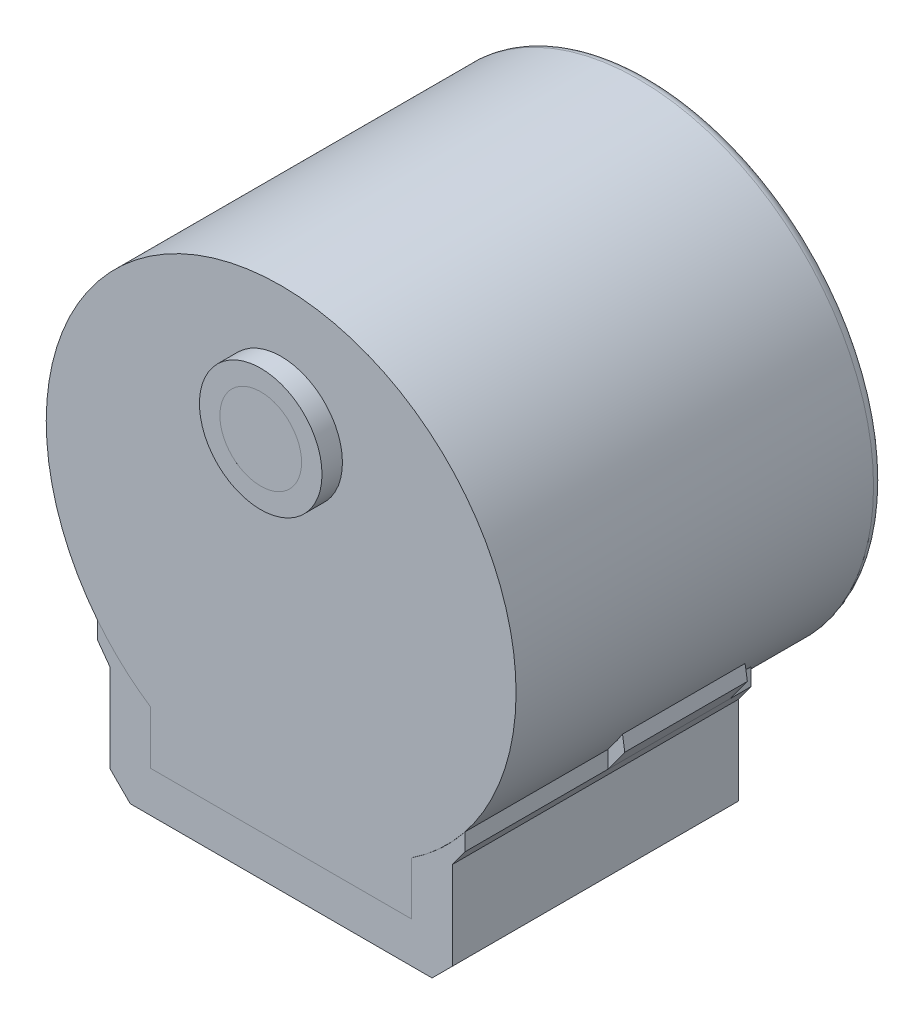
from build123d import *

# Parameters (mm, degrees)
SKETCH1_R             = 11.5
BOSS_EXTRUDE1_DEPTH   = 18
BOSS_EXTRUDE4_DEPTH   = 14
CHAMFER2_SIZE         = 1
BOSS_EXTRUDE5_DEPTH   = 6
BOSS_EXTRUDE5_2_DEPTH = 6
FILLET1_R             = 0.5
BOSS_EXTRUDE9_DEPTH   = 0.0001
SKETCH10_R            = 3
BOSS_EXTRUDE10_DEPTH  = 1
SKETCH12_R            = 2
CUT_EXTRUDE2_DEPTH    = 1
SKETCH6_R             = 3
BOSS_EXTRUDE6_DEPTH   = 1
SKETCH13_R            = 10.326369643
BOSS_EXTRUDE11_DEPTH  = 0.001
BOSS_EXTRUDE13_DEPTH  = 0.0001
BOSS_EXTRUDE14_DEPTH  = 0.0001
BOSS_EXTRUDE15_DEPTH  = 0.0001


with BuildPart() as part:
    # Sketch1 → Boss-Extrude1 (new body)
    with BuildSketch(Plane.XY):
        Circle(SKETCH1_R)
    extrude(amount=BOSS_EXTRUDE1_DEPTH)

    # Sketch2 → Boss-Extrude4 (add)
    with BuildSketch(Plane.XY.offset(18)):
        Polygon((-9, -7.158910532), (9, -7.158910532), (9, -8.001421733), (8.388098891, -8.843932934), (8.388098891, -14.158910532), (-8.388098891, -14.158910532), (-8.388098891, -8.843932934), (-9, -8.001421733), align=None)
    extrude(amount=-BOSS_EXTRUDE4_DEPTH)

    # Chamfer2
    chamfer2_edges = [part.edges().sort_by_distance(p)[0] for p in [
        (8.388098891, -14.158910532, 11),
        (-8.388098891, -14.158910532, 11),
    ]]
    chamfer(chamfer2_edges, length=CHAMFER2_SIZE)

    # Fillet1
    fillet1_edges = [part.edges().sort_by_distance(p)[0] for p in [
        (-11.5, 0, 0),
    ]]
    fillet(fillet1_edges, radius=FILLET1_R)

    # Sketch9 → Boss-Extrude9 (add)
    with BuildSketch(Plane.XY.offset(18)):
        with BuildLine():
            Line((-6.388098891, -9.562541114), (-6.388098891, -12.158910532))
            Line((-6.388098891, -12.158910532), (6.388098891, -12.158910532))
            Line((6.388098891, -12.158910532), (6.388098891, -9.562541114))
            ThreePointArc((6.388098891, -9.562541114), (0, 11.5), (-6.388098891, -9.562541114))
        make_face()
    extrude(amount=BOSS_EXTRUDE9_DEPTH)

    # Sketch10 → Boss-Extrude10 (add)
    with BuildSketch(Plane.XY.offset(18.0001)):
        with Locations((0, 5.5)):
            Circle(SKETCH10_R)
    extrude(amount=BOSS_EXTRUDE10_DEPTH)

    # Sketch12 → Cut-Extrude2 (cut)
    with BuildSketch(Plane.XY.offset(19.0001)):
        with Locations((0, 5.5)):
            Circle(SKETCH12_R)
    extrude(amount=-CUT_EXTRUDE2_DEPTH, mode=Mode.SUBTRACT)

    # Sketch6 → Boss-Extrude6 (add)
    with BuildSketch(Plane.XY.offset(18)):
        with Locations((0, 5.5)):
            Circle(SKETCH6_R)
    extrude(amount=BOSS_EXTRUDE6_DEPTH)

    # Sketch13 → Boss-Extrude11 (add)
    with BuildSketch(Plane(origin=(0, 0, 0), x_dir=(-1, 0, 0), z_dir=(0, 0, -1))):
        Circle(SKETCH13_R)
    extrude(amount=BOSS_EXTRUDE11_DEPTH)

    # Sketch15 → Boss-Extrude13 (add)
    # profile 1 of 4: a face of its own
    with BuildSketch(Plane(origin=(0, 0, -0.001), x_dir=(-1, 0, 0), z_dir=(0, 0, -1))):
        with BuildLine():
            Line((-3.525948268, 2.886972128), (-3.0540933, 2.886972128))
            add(Edge.make_bspline(
                [(-3.0540933, 2.886972128), (-3.022543158, 2.886821436), (-2.962239571, 2.886533409), (-2.875485529, 2.88481025), (-2.796763179, 2.880101897), (-2.725820575, 2.875989375), (-2.663254001, 2.868436735), (-2.608367845, 2.861342564), (-2.56123852, 2.851756311), (-2.532876882, 2.843220104), (-2.519838492, 2.839295846)],
                knots=[0, 0, 0, 0, 1.407275241, 2.689805482, 3.869373952, 4.924720992, 5.858292571, 6.679408083, 7.392898528, 8, 8, 8, 8], degree=3))
            add(Edge.make_bspline(
                [(-2.519838492, 2.839295846), (-2.502604036, 2.832914271), (-2.467997406, 2.820100128), (-2.418974943, 2.793550707), (-2.37188824, 2.762822521), (-2.327272396, 2.726853288), (-2.286048036, 2.684987409), (-2.246624288, 2.638786935), (-2.21003462, 2.587031801), (-2.176143356, 2.53076706), (-2.144861926, 2.470330489), (-2.11886731, 2.405749743), (-2.095040047, 2.338412458), (-2.07746815, 2.26712436), (-2.062228284, 2.193085978), (-2.053000074, 2.115211985), (-2.046279623, 2.034292327), (-2.045549696, 1.979034569), (-2.045179037, 1.950974532)],
                knots=[0, 0, 0, 0, 0.821157898, 1.648877476, 2.486832402, 3.334190097, 4.20646043, 5.111323736, 6.04828789, 7.037949131, 8.047833053, 9.088416927, 10.149643438, 11.239924972, 12.369590127, 13.528810539, 14.745123422, 16, 16, 16, 16], degree=3))
            add(Edge.make_bspline(
                [(-2.045179037, 1.950974532), (-2.046116805, 1.904405086), (-2.047938248, 1.813952451), (-2.066022358, 1.682720441), (-2.094477668, 1.560029388), (-2.134073946, 1.446505899), (-2.184228953, 1.343791524), (-2.244722313, 1.253250991), (-2.316337383, 1.177008838), (-2.383651923, 1.123712025), (-2.443252575, 1.088860896), (-2.491924385, 1.065731308), (-2.545021807, 1.047222368), (-2.601524755, 1.030643885), (-2.66230531, 1.018402837), (-2.72714964, 1.009288019), (-2.795981898, 1.003635525), (-2.843278498, 1.002790958), (-2.867594903, 1.002356744)],
                knots=[0, 0, 0, 0, 1.559350929, 3.028754108, 4.428415989, 5.773036121, 7.047604298, 8.248499058, 9.406249285, 10.538623137, 11.110667115, 11.716589909, 12.340703643, 12.992445201, 13.688047783, 14.415527693, 15.185381842, 16, 16, 16, 16], degree=3))
            Line((-2.867594903, 1.002356744), (-2.000307242, -0.613027872))
            Line((-2.000307242, -0.613027872), (-2.284962691, -0.613027872))
            Line((-2.284962691, -0.613027872), (-3.152250351, 1.002356744))
            Line((-3.152250351, 1.002356744), (-3.301589294, 1.002356744))
            Line((-3.301589294, 1.002356744), (-3.301589294, -0.613027872))
            Line((-3.301589294, -0.613027872), (-3.525948268, -0.613027872))
            Line((-3.525948268, -0.613027872), (-3.525948268, 2.886972128))
        make_face()
        with BuildLine():
            Line((-3.301589294, 2.527997769), (-3.301589294, 1.361331103))
            Line((-3.301589294, 1.361331103), (-2.880215095, 1.35642325))
            add(Edge.make_bspline(
                [(-2.880215095, 1.35642325), (-2.842090464, 1.357196131), (-2.770770506, 1.358641964), (-2.671720464, 1.369876633), (-2.588225294, 1.389569404), (-2.518805075, 1.418568227), (-2.461788775, 1.458386516), (-2.411484889, 1.505773149), (-2.369914839, 1.564588606), (-2.33317962, 1.630891376), (-2.305485445, 1.704827337), (-2.283683581, 1.78328458), (-2.272141419, 1.866263547), (-2.27041514, 1.922898991), (-2.269538012, 1.951675654)],
                knots=[0, 0, 0, 0, 1.395459073, 2.610493045, 3.641753297, 4.526968964, 5.345645002, 6.17462708, 7.043906644, 7.970450467, 8.942786324, 9.926497544, 10.946446294, 12, 12, 12, 12], degree=3))
            add(Edge.make_bspline(
                [(-2.269538012, 1.951675654), (-2.270296535, 1.979776002), (-2.271789909, 2.035099721), (-2.285050012, 2.115850198), (-2.304755059, 2.193128976), (-2.334707846, 2.264641449), (-2.369232983, 2.33034316), (-2.411159424, 2.386339786), (-2.457612296, 2.433014488), (-2.512091952, 2.469911656), (-2.57845377, 2.49725898), (-2.660457763, 2.514888177), (-2.759506001, 2.52684396), (-2.831559764, 2.527593656), (-2.87039939, 2.527997769)],
                knots=[0, 0, 0, 0, 1.050889885, 2.068982756, 3.055515424, 4.02842232, 4.963806102, 5.826211733, 6.636431298, 7.417566748, 8.27204102, 9.305238015, 10.547424284, 12, 12, 12, 12], degree=3))
            Line((-2.87039939, 2.527997769), (-3.301589294, 2.527997769))
        make_face(mode=Mode.SUBTRACT)
    # profile 2 of 4: a face of its own
    with BuildSketch(Plane(origin=(0, 0, -0.001), x_dir=(-1, 0, 0), z_dir=(0, 0, -1))):
        with BuildLine():
            add(Edge.make_bspline(
                [(-0.743195864, 1.989536231), (-0.710589609, 1.988507722), (-0.64634692, 1.986481296), (-0.552508143, 1.964760899), (-0.462871147, 1.931773349), (-0.37694895, 1.885938213), (-0.296812751, 1.82519744), (-0.220680608, 1.752049352), (-0.147904169, 1.66643579), (-0.105858781, 1.601633762), (-0.084141377, 1.568162032)],
                knots=[0, 0, 0, 0, 0.953316864, 1.878278806, 2.805087309, 3.745143774, 4.718373443, 5.739791154, 6.832550422, 8, 8, 8, 8], degree=3))
            add(Edge.make_bspline(
                [(-0.084141377, 1.568162032), (-0.065135071, 1.535730892), (-0.026928901, 1.47053834), (0.020643433, 1.367200418), (0.062925409, 1.260359595), (0.095391369, 1.148214899), (0.121237717, 1.032040533), (0.140321271, 0.911490445), (0.15173039, 0.786634728), (0.152930173, 0.701833163), (0.153538911, 0.658807064)],
                knots=[0, 0, 0, 0, 0.947011543, 1.903667277, 2.864215, 3.840975266, 4.842905076, 5.862773124, 6.915626928, 8, 8, 8, 8], degree=3))
            add(Edge.make_bspline(
                [(0.153538911, 0.658807064), (0.152619153, 0.615551673), (0.150806387, 0.530298988), (0.139799083, 0.404429046), (0.119809642, 0.282718404), (0.093087468, 0.164844072), (0.056470536, 0.051597044), (0.014464393, -0.058142322), (-0.03757542, -0.162959432), (-0.095405433, -0.263003454), (-0.159659091, -0.354954175), (-0.229469456, -0.435523317), (-0.303185442, -0.504540718), (-0.382558608, -0.560475657), (-0.466219136, -0.604274383), (-0.554422967, -0.635628062), (-0.647294468, -0.65425469), (-0.710859449, -0.656670639), (-0.743195864, -0.657899667)],
                knots=[0, 0, 0, 0, 1.179143013, 2.323990292, 3.440410231, 4.539095879, 5.614957591, 6.682013268, 7.739000084, 8.801004604, 9.829641189, 10.791486682, 11.702119209, 12.575235445, 13.43003252, 14.26821791, 15.119017693, 16, 16, 16, 16], degree=3))
            add(Edge.make_bspline(
                [(-0.743195864, -0.657899667), (-0.775532651, -0.656661644), (-0.839327752, -0.654219231), (-0.932631482, -0.635578916), (-1.021256817, -0.60461203), (-1.104674954, -0.560270624), (-1.183949407, -0.504348481), (-1.258326948, -0.435775102), (-1.328102181, -0.354918756), (-1.392392814, -0.263012063), (-1.450236883, -0.162962896), (-1.502181061, -0.058119893), (-1.544534351, 0.051444207), (-1.57973647, 0.165093893), (-1.607906889, 0.282587084), (-1.627507054, 0.404450689), (-1.638622845, 0.530293329), (-1.640420693, 0.615549769), (-1.641332883, 0.658807064)],
                knots=[0, 0, 0, 0, 0.880385174, 1.73685346, 2.58047298, 3.429050009, 4.301574444, 5.216276051, 6.177469602, 7.205408974, 8.266693664, 9.322964051, 10.389296474, 11.462523686, 12.56192169, 13.677584916, 14.821656214, 16, 16, 16, 16], degree=3))
            add(Edge.make_bspline(
                [(-1.641332883, 0.658807064), (-1.640718731, 0.701599303), (-1.639505023, 0.786166817), (-1.628106948, 0.910788353), (-1.609097322, 1.03111742), (-1.583231824, 1.14683842), (-1.550405234, 1.258609915), (-1.508802809, 1.365486644), (-1.460648925, 1.46856849), (-1.422622563, 1.533611218), (-1.403652595, 1.566058667)],
                knots=[0, 0, 0, 0, 1.08079722, 2.135909171, 3.15796462, 4.156281795, 5.129476821, 6.097590791, 7.050957319, 8, 8, 8, 8], degree=3))
            add(Edge.make_bspline(
                [(-1.403652595, 1.566058667), (-1.381987287, 1.599807303), (-1.340140665, 1.664992919), (-1.266812476, 1.750557496), (-1.191221004, 1.82483722), (-1.109984065, 1.884851002), (-1.024458503, 1.931953185), (-0.934343059, 1.964820985), (-0.840269713, 1.986426275), (-0.775800854, 1.988491664), (-0.743195864, 1.989536231)],
                knots=[0, 0, 0, 0, 1.169336495, 2.258577748, 3.281427306, 4.257001412, 5.197279076, 6.121103825, 7.049752231, 8, 8, 8, 8], degree=3))
        make_face()
        with BuildLine():
            add(Edge.make_bspline(
                [(-0.743896986, 1.675433667), (-0.766642891, 1.674472866), (-0.811637456, 1.67257227), (-0.877710121, 1.657849735), (-0.941216002, 1.634686658), (-1.002359095, 1.601884174), (-1.060621224, 1.55920574), (-1.11685676, 1.507777727), (-1.170439148, 1.446908912), (-1.220012642, 1.377226269), (-1.265938076, 1.301295044), (-1.306866394, 1.220902774), (-1.340185821, 1.136140645), (-1.368742421, 1.048014741), (-1.390226864, 0.955565999), (-1.40528395, 0.859236299), (-1.41584218, 0.759300695), (-1.416592053, 0.69132088), (-1.416973909, 0.656703699)],
                knots=[0, 0, 0, 0, 0.812010353, 1.606269465, 2.406649113, 3.220974234, 4.076097956, 4.98035605, 5.938625786, 6.967482768, 8.03141706, 9.10682197, 10.18594796, 11.281773775, 12.413897075, 13.572437299, 14.763818652, 16, 16, 16, 16], degree=3))
            add(Edge.make_bspline(
                [(-1.416973909, 0.656703699), (-1.415901089, 0.61201679), (-1.41378136, 0.523722281), (-1.396790937, 0.393577642), (-1.367702487, 0.268415793), (-1.329065306, 0.149221539), (-1.280556042, 0.038807245), (-1.223240272, -0.059604316), (-1.158394734, -0.145316042), (-1.085332712, -0.216424896), (-1.006170238, -0.273057231), (-0.922206753, -0.313456407), (-0.834526978, -0.339868628), (-0.774230799, -0.342482244), (-0.743896986, -0.343797103)],
                knots=[0, 0, 0, 0, 1.20838902, 2.38759222, 3.542210294, 4.679604706, 5.771967188, 6.797545264, 7.753349372, 8.669734747, 9.544904936, 10.373258743, 11.181618685, 12, 12, 12, 12], degree=3))
            add(Edge.make_bspline(
                [(-0.743896986, -0.343797103), (-0.713561541, -0.34248469), (-0.65326212, -0.339875937), (-0.565606635, -0.313427291), (-0.481719482, -0.273254725), (-0.403071722, -0.216200954), (-0.330130409, -0.145129382), (-0.264463736, -0.059848361), (-0.207285701, 0.038842792), (-0.158714932, 0.149211319), (-0.120095286, 0.268418622), (-0.091001992, 0.393576865), (-0.074012883, 0.523722483), (-0.071892974, 0.612016858), (-0.070820063, 0.656703699)],
                knots=[0, 0, 0, 0, 0.81846946, 1.626916467, 2.455359493, 3.325471984, 4.241956059, 5.201722598, 6.227411136, 7.319891272, 8.457408188, 9.612150622, 10.791480829, 12, 12, 12, 12], degree=3))
            add(Edge.make_bspline(
                [(-0.070820063, 0.656703699), (-0.071201365, 0.691321118), (-0.071950152, 0.759301399), (-0.082516235, 0.859233631), (-0.097544714, 0.955575614), (-0.119132016, 1.047980191), (-0.14734683, 1.136347823), (-0.182014031, 1.220513381), (-0.221558098, 1.301702833), (-0.268571996, 1.377214016), (-0.31872674, 1.446765869), (-0.372323794, 1.507534676), (-0.427904998, 1.559427217), (-0.486162875, 1.601854516), (-0.547272157, 1.634694125), (-0.610786858, 1.657848384), (-0.676628287, 1.672519397), (-0.721386103, 1.674458432), (-0.743896986, 1.675433667)],
                knots=[0, 0, 0, 0, 1.236632221, 2.428448107, 3.587410887, 4.719947107, 5.816172602, 6.898822026, 7.970883808, 9.039556281, 10.073691182, 11.032310428, 11.93074605, 12.786181662, 13.600803792, 14.401475363, 15.196024166, 16, 16, 16, 16], degree=3))
        make_face(mode=Mode.SUBTRACT)
    # profile 3 of 4: a face of its own
    with BuildSketch(Plane(origin=(0, 0, -0.001), x_dir=(-1, 0, 0), z_dir=(0, 0, -1))):
        Polygon((0.69200045, 2.886972128), (0.916359424, 2.886972128), (0.916359424, 1.451074692), (2.127897886, 1.451074692), (2.127897886, 2.886972128), (2.35225686, 2.886972128), (2.35225686, -0.613027872), (2.127897886, -0.613027872), (2.127897886, 1.092100333), (0.916359424, 1.092100333), (0.916359424, -0.613027872), (0.69200045, -0.613027872), align=None)
    # profile 4 of 4: a face of its own
    with BuildSketch(Plane(origin=(0, 0, -0.001), x_dir=(-1, 0, 0), z_dir=(0, 0, -1))):
        with BuildLine():
            Line((2.711231219, 0.062152417), (2.91455654, 0.239536231))
            add(Edge.make_bspline(
                [(2.91455654, 0.239536231), (2.933533222, 0.193666723), (2.969498501, 0.106733211), (3.030582826, -0.012164853), (3.09314987, -0.113625777), (3.159100106, -0.19622394), (3.226612002, -0.26207911), (3.297620886, -0.308665054), (3.371547177, -0.338400303), (3.422382857, -0.342016741), (3.447409104, -0.343797103)],
                knots=[0, 0, 0, 0, 1.4274707, 2.705392895, 3.841360332, 4.850387436, 5.739695495, 6.54155184, 7.282010527, 8, 8, 8, 8], degree=3))
            add(Edge.make_bspline(
                [(3.447409104, -0.343797103), (3.468781329, -0.342940802), (3.511394525, -0.34123346), (3.573948013, -0.324589181), (3.634791258, -0.29961567), (3.691944404, -0.263292271), (3.745336166, -0.219364882), (3.792361562, -0.167401847), (3.831977948, -0.108132865), (3.864714304, -0.043057128), (3.890203922, 0.026728093), (3.909272414, 0.098967992), (3.920990006, 0.173480951), (3.922171149, 0.223835352), (3.922769681, 0.249351936)],
                knots=[0, 0, 0, 0, 0.910355865, 1.815120956, 2.745047303, 3.708239851, 4.692884706, 5.688582042, 6.687272463, 7.726626752, 8.790156954, 9.852236194, 10.911642353, 12, 12, 12, 12], degree=3))
            add(Edge.make_bspline(
                [(3.922769681, 0.249351936), (3.921592063, 0.278395604), (3.919219226, 0.336917045), (3.902919128, 0.424050291), (3.874284608, 0.510009694), (3.84789866, 0.564886424), (3.834428334, 0.592901615)],
                knots=[0, 0, 0, 0, 0.973184621, 1.960915033, 2.959024035, 4, 4, 4, 4], degree=3))
            add(Edge.make_bspline(
                [(3.834428334, 0.592901615), (3.82343869, 0.612900832), (3.8005507, 0.65455294), (3.760186875, 0.716845089), (3.713582733, 0.782113764), (3.661347319, 0.850711063), (3.601832846, 0.92154823), (3.536813864, 0.995834024), (3.465248981, 1.072970095), (3.414589996, 1.124480962), (3.388514873, 1.150994564)],
                knots=[0, 0, 0, 0, 0.763930207, 1.591027513, 2.483480193, 3.449232408, 4.477278696, 5.580830734, 6.75480852, 8, 8, 8, 8], degree=3))
            add(Edge.make_bspline(
                [(3.388514873, 1.150994564), (3.36238899, 1.177227108), (3.312340278, 1.227480148), (3.243489079, 1.302319083), (3.18061586, 1.36972234), (3.126599886, 1.432552222), (3.079797583, 1.489069384), (3.039778151, 1.539351581), (3.009026021, 1.584984674), (2.991802989, 1.613901111), (2.983967597, 1.627056263)],
                knots=[0, 0, 0, 0, 1.418850322, 2.718056736, 3.897251478, 4.951422659, 5.8930247, 6.710073348, 7.413164863, 8, 8, 8, 8], degree=3))
            add(Edge.make_bspline(
                [(2.983967597, 1.627056263), (2.962706996, 1.668389477), (2.920354665, 1.7507276), (2.877664957, 1.882883709), (2.850290616, 2.019714542), (2.847339914, 2.112799693), (2.845846604, 2.159908827)],
                knots=[0, 0, 0, 0, 1.001108881, 1.994266056, 2.984925235, 4, 4, 4, 4], degree=3))
            add(Edge.make_bspline(
                [(2.845846604, 2.159908827), (2.846742376, 2.19688923), (2.848507238, 2.269748449), (2.863822542, 2.376265416), (2.887141196, 2.478247144), (2.921649074, 2.573727857), (2.964056294, 2.662456359), (3.014983575, 2.74180171), (3.074208991, 2.811129464), (3.140354774, 2.869938786), (3.21278064, 2.916988467), (3.288557616, 2.952119262), (3.368310505, 2.972408914), (3.422292942, 2.975272044), (3.449512469, 2.976715718)],
                knots=[0, 0, 0, 0, 1.181416684, 2.327640837, 3.432896955, 4.519774552, 5.565493565, 6.570422845, 7.524069226, 8.471345662, 9.389213005, 10.275123969, 11.130266921, 12, 12, 12, 12], degree=3))
            add(Edge.make_bspline(
                [(3.449512469, 2.976715718), (3.47841671, 2.975266012), (3.53651374, 2.972352126), (3.621742844, 2.947317895), (3.70329141, 2.906274379), (3.768163726, 2.860173451), (3.818490074, 2.814043838), (3.858027031, 2.772674292), (3.896803762, 2.723610515), (3.937906761, 2.669262447), (3.978012916, 2.607163501), (4.019781748, 2.539244221), (4.060670144, 2.463870979), (4.08807458, 2.4114148), (4.10225686, 2.384267801)],
                knots=[0, 0, 0, 0, 1.116951945, 2.245054374, 3.405965832, 4.638253071, 5.310557091, 6.04630686, 6.850074719, 7.729237936, 8.682511397, 9.709406364, 10.81457734, 12, 12, 12, 12], degree=3))
            Line((4.10225686, 2.384267801), (3.907345001, 2.16902341))
            add(Edge.make_bspline(
                [(3.907345001, 2.16902341), (3.895255987, 2.191026918), (3.872125908, 2.233126532), (3.837775451, 2.293256925), (3.804296209, 2.34702565), (3.771924871, 2.394899299), (3.741171, 2.437098427), (3.711726159, 2.473623812), (3.684038388, 2.504732269), (3.648678636, 2.537114827), (3.604443681, 2.569523445), (3.548315788, 2.597454655), (3.489520867, 2.614434305), (3.449387692, 2.61663385), (3.429179937, 2.617741359)],
                knots=[0, 0, 0, 0, 1.309793075, 2.506045177, 3.612360285, 4.613350274, 5.520539379, 6.33553705, 7.060566944, 7.690470518, 8.834311878, 9.908515481, 10.946901003, 12, 12, 12, 12], degree=3))
            add(Edge.make_bspline(
                [(3.429179937, 2.617741359), (3.403700373, 2.616511269), (3.354017455, 2.614112702), (3.283991396, 2.587729004), (3.22123389, 2.546800855), (3.168184304, 2.490079229), (3.123718923, 2.42324654), (3.093091885, 2.346538048), (3.073476921, 2.263022862), (3.071317005, 2.204662743), (3.070205578, 2.174632385)],
                knots=[0, 0, 0, 0, 0.957930279, 1.867880082, 2.78566855, 3.76545862, 4.778691267, 5.799579728, 6.867730067, 8, 8, 8, 8], degree=3))
            add(Edge.make_bspline(
                [(3.070205578, 2.174632385), (3.072077726, 2.137334298), (3.07581996, 2.062779183), (3.09818308, 1.970782647), (3.125880328, 1.897759621), (3.155352126, 1.841301487), (3.1903723, 1.781686104), (3.218278076, 1.742758337), (3.232865834, 1.722408827)],
                knots=[0, 0, 0, 0, 1.37118372, 2.740858038, 3.459154736, 4.239466331, 5.07968016, 6, 6, 6, 6], degree=3))
            add(Edge.make_bspline(
                [(3.232865834, 1.722408827), (3.238154763, 1.71555867), (3.250729774, 1.699271665), (3.274931461, 1.673318966), (3.305347067, 1.639509038), (3.343672125, 1.599737768), (3.388465573, 1.552236991), (3.441393532, 1.499276604), (3.500882886, 1.438877814), (3.542984019, 1.396376163), (3.565197565, 1.373951295)],
                knots=[0, 0, 0, 0, 0.430988114, 1.024721792, 1.76647773, 2.697202889, 3.776087901, 5.019389473, 6.42735995, 8, 8, 8, 8], degree=3))
            add(Edge.make_bspline(
                [(3.565197565, 1.373951295), (3.591978003, 1.346270382), (3.644064975, 1.292432019), (3.717840314, 1.211657022), (3.785360979, 1.133420293), (3.8455066, 1.056834681), (3.899835207, 0.983156535), (3.947760562, 0.911819971), (3.988542814, 0.842178142), (4.033883164, 0.753567409), (4.078471974, 0.643512194), (4.118610835, 0.511119168), (4.142535255, 0.377824302), (4.145604337, 0.288706249), (4.147128655, 0.244444083)],
                knots=[0, 0, 0, 0, 1.061650765, 2.064871852, 3.015192632, 3.909651769, 4.748487401, 5.538240563, 6.277422274, 6.971787199, 8.280588746, 9.544330434, 10.780345287, 12, 12, 12, 12], degree=3))
            add(Edge.make_bspline(
                [(4.147128655, 0.244444083), (4.146332143, 0.21311157), (4.144759583, 0.151251478), (4.13599318, 0.059965731), (4.119312203, -0.027971178), (4.098030024, -0.113305659), (4.069120501, -0.19532475), (4.033865315, -0.273934936), (3.993113094, -0.349728122), (3.945921744, -0.42085397), (3.894565516, -0.486493782), (3.839952159, -0.544392381), (3.782216513, -0.593299522), (3.721353652, -0.632923223), (3.657801377, -0.664108069), (3.591657547, -0.686650875), (3.522549846, -0.700643392), (3.475520429, -0.702054307), (3.451615834, -0.702771462)],
                knots=[0, 0, 0, 0, 1.158720575, 2.287673511, 3.385950382, 4.465299485, 5.536593632, 6.596465733, 7.64816921, 8.714678197, 9.748443524, 10.726384082, 11.652440184, 12.539243327, 13.404912843, 14.26295822, 15.117078591, 16, 16, 16, 16], degree=3))
            add(Edge.make_bspline(
                [(3.451615834, -0.702771462), (3.433114828, -0.702263561), (3.396386876, -0.701255282), (3.342235964, -0.69221577), (3.289098355, -0.679386442), (3.237953366, -0.65917584), (3.187674354, -0.634492358), (3.138611188, -0.604515288), (3.091418936, -0.568039809), (3.044882246, -0.526698851), (2.999579337, -0.478386581), (2.955739067, -0.422742721), (2.911959392, -0.360278562), (2.870354089, -0.289813201), (2.828748194, -0.21248503), (2.788491454, -0.127602169), (2.748099196, -0.035718499), (2.723779167, 0.02884223), (2.711231219, 0.062152417)],
                knots=[0, 0, 0, 0, 0.781108757, 1.550646757, 2.314652786, 3.086720919, 3.868391243, 4.679628978, 5.511108479, 6.385293484, 7.30741185, 8.305206797, 9.376292927, 10.527882923, 11.760494076, 13.085521883, 14.49627147, 16, 16, 16, 16], degree=3))
        make_face()
    extrude(amount=BOSS_EXTRUDE13_DEPTH)

    # Sketch16 → Boss-Extrude14 (add)
    # profile 1 of 7: a face of its own
    with BuildSketch(Plane(origin=(0, 0, -0.001), x_dir=(-1, 0, 0), z_dir=(0, 0, -1))):
        with BuildLine():
            Line((-2.92792156, 5.936670841), (-3.062536944, 5.936670841))
            add(Edge.make_bspline(
                [(-3.062536944, 5.936670841), (-3.061639613, 5.978280792), (-3.059884136, 6.059683584), (-3.0527546, 6.178701341), (-3.042513724, 6.292178156), (-3.027806152, 6.399760875), (-3.00945665, 6.501952287), (-2.988250242, 6.598549607), (-2.962047239, 6.689249907), (-2.932975286, 6.773583529), (-2.901319198, 6.850131408), (-2.867258873, 6.917256792), (-2.830570689, 6.973676276), (-2.793091415, 7.020898573), (-2.752632103, 7.05717834), (-2.710827559, 7.08411524), (-2.666192548, 7.100667313), (-2.635451413, 7.102449307), (-2.620129092, 7.103337508)],
                knots=[0, 0, 0, 0, 1.499044431, 2.932625415, 4.293837702, 5.602250345, 6.842368616, 8.033041629, 9.162785747, 10.241015594, 11.244734119, 12.144584578, 12.947813535, 13.665690747, 14.309565158, 14.895830339, 15.449648073, 16, 16, 16, 16], degree=3))
            add(Edge.make_bspline(
                [(-2.620129092, 7.103337508), (-2.60505573, 7.102393717), (-2.574878129, 7.100504201), (-2.531160826, 7.084992165), (-2.490667873, 7.059283868), (-2.451362153, 7.025375973), (-2.416201509, 6.98018603), (-2.382114926, 6.926309939), (-2.351200941, 6.862310084), (-2.311516703, 6.76328408), (-2.270172331, 6.625815802), (-2.234790202, 6.448125335), (-2.21369564, 6.256422838), (-2.211240563, 6.124158506), (-2.209972842, 6.055861546)],
                knots=[0, 0, 0, 0, 0.449190805, 0.899301807, 1.365979003, 1.875299848, 2.440824153, 3.06797826, 3.776272418, 4.558816679, 6.251583603, 8.052270926, 9.961522281, 12, 12, 12, 12], degree=3))
            add(Edge.make_bspline(
                [(-2.209972842, 6.055861546), (-2.21068331, 6.007000277), (-2.2120819, 5.910814495), (-2.222031989, 5.768760644), (-2.238518843, 5.631318772), (-2.259214554, 5.518932314), (-2.278702706, 5.427622906), (-2.297419008, 5.353928044), (-2.318079517, 5.274060417), (-2.343002137, 5.188683855), (-2.370084447, 5.097379731), (-2.401262913, 5.000792755), (-2.434786742, 4.898070219), (-2.458999106, 4.827928157), (-2.471491271, 4.79173895)],
                knots=[0, 0, 0, 0, 1.355088937, 2.66755837, 3.947484853, 5.192214577, 5.835517292, 6.536663773, 7.300749649, 8.123430825, 9.003169876, 9.942028091, 10.938206709, 12, 12, 12, 12], degree=3))
            Line((-2.471491271, 4.79173895), (-2.796110662, 3.872568277))
            Line((-2.796110662, 3.872568277), (-2.209972842, 3.872568277))
            Line((-2.209972842, 3.872568277), (-2.209972842, 3.513593918))
            Line((-2.209972842, 3.513593918), (-3.107408739, 3.513593918))
            Line((-3.107408739, 3.513593918), (-2.594888707, 4.962111546))
            add(Edge.make_bspline(
                [(-2.594888707, 4.962111546), (-2.582521597, 4.996706605), (-2.558634062, 5.063528256), (-2.523810545, 5.159961998), (-2.494101792, 5.25001932), (-2.466285075, 5.332758185), (-2.442750643, 5.408819242), (-2.422053826, 5.477901692), (-2.405258352, 5.540100313), (-2.387326194, 5.614207594), (-2.370133188, 5.703652564), (-2.355604128, 5.811557174), (-2.345938413, 5.922238838), (-2.345042505, 5.996946621), (-2.344588226, 6.034827892)],
                knots=[0, 0, 0, 0, 1.193533438, 2.305354461, 3.330536343, 4.274088284, 5.140971689, 5.916908005, 6.616757519, 7.233650198, 8.393579676, 9.573610511, 10.76967679, 12, 12, 12, 12], degree=3))
            add(Edge.make_bspline(
                [(-2.344588226, 6.034827892), (-2.345409245, 6.081612888), (-2.346994589, 6.17195226), (-2.362540414, 6.302485865), (-2.388434561, 6.422874312), (-2.417886282, 6.515836797), (-2.446490506, 6.582344011), (-2.46775217, 6.625427423), (-2.491051957, 6.66164829), (-2.515592235, 6.691508299), (-2.541408375, 6.715037515), (-2.568747499, 6.731728902), (-2.597200659, 6.742129014), (-2.616776875, 6.743624845), (-2.626439188, 6.744363149)],
                knots=[0, 0, 0, 0, 2.062872672, 3.983298928, 5.786766131, 7.488375381, 8.273413203, 8.978743094, 9.604909505, 10.168468702, 10.679523563, 11.137391389, 11.574238784, 12, 12, 12, 12], degree=3))
            add(Edge.make_bspline(
                [(-2.626439188, 6.744363149), (-2.636805428, 6.743666178), (-2.657313459, 6.742287328), (-2.687245584, 6.731689168), (-2.715363933, 6.714496052), (-2.742175047, 6.690863254), (-2.767689322, 6.660913314), (-2.791253117, 6.62381894), (-2.814426448, 6.580637561), (-2.834948378, 6.530600868), (-2.854691445, 6.475245319), (-2.872232064, 6.414177696), (-2.886613787, 6.347576824), (-2.899038136, 6.275713855), (-2.910564355, 6.198648763), (-2.918784572, 6.116051804), (-2.924083947, 6.028093205), (-2.926616611, 5.967758259), (-2.92792156, 5.936670841)],
                knots=[0, 0, 0, 0, 0.539748328, 1.067809999, 1.636377399, 2.249814592, 2.924052586, 3.681314582, 4.537382194, 5.476850829, 6.498438571, 7.601756026, 8.787622413, 10.050065741, 11.404916499, 12.850584902, 14.37727237, 16, 16, 16, 16], degree=3))
        make_face()
    # profile 2 of 7: a face of its own
    with BuildSketch(Plane(origin=(0, 0, -0.001), x_dir=(-1, 0, 0), z_dir=(0, 0, -1))):
        Polygon((-1.384752489, 7.103337508), (-1.357408739, 7.103337508), (-1.357408739, 4.680260585), (-1.17792156, 4.680260585), (-1.17792156, 4.321286226), (-1.357408739, 4.321286226), (-1.357408739, 3.513593918), (-1.492024124, 3.513593918), (-1.492024124, 4.321286226), (-2.075357457, 4.321286226), align=None)
        Polygon((-1.492024124, 4.680260585), (-1.492024124, 6.025713309), (-1.825758098, 4.680260585), align=None, mode=Mode.SUBTRACT)
    # profile 3 of 7: a face of its own
    with BuildSketch(Plane(origin=(0, 0, -0.001), x_dir=(-1, 0, 0), z_dir=(0, 0, -1))):
        with BuildLine():
            Line((-0.90869079, 7.013593918), (-0.63525329, 7.013593918))
            add(Edge.make_bspline(
                [(-0.63525329, 7.013593918), (-0.609171064, 7.012547622), (-0.559507147, 7.01055534), (-0.490050247, 6.991088891), (-0.42949064, 6.959929394), (-0.379297807, 6.913665981), (-0.337330908, 6.854959611), (-0.298720367, 6.784669525), (-0.267854958, 6.699921998), (-0.239903843, 6.603947004), (-0.218229413, 6.498622826), (-0.20174431, 6.386296403), (-0.193087335, 6.268203932), (-0.191533675, 6.187450713), (-0.190742072, 6.146306258)],
                knots=[0, 0, 0, 0, 0.863572243, 1.644352737, 2.372820216, 3.103101446, 3.884767113, 4.75923758, 5.755801704, 6.86996728, 8.074485777, 9.320281437, 10.634660475, 12, 12, 12, 12], degree=3))
            add(Edge.make_bspline(
                [(-0.190742072, 6.146306258), (-0.191341472, 6.107735341), (-0.192512439, 6.032384447), (-0.19987583, 5.921824243), (-0.214201663, 5.816808307), (-0.232651471, 5.717680532), (-0.256351536, 5.625779815), (-0.284532428, 5.542184721), (-0.318817228, 5.467562944), (-0.34685257, 5.423182284), (-0.360413547, 5.401714912)],
                knots=[0, 0, 0, 0, 1.196068896, 2.336601426, 3.433237214, 4.480715612, 5.461496165, 6.373611333, 7.213299426, 8, 8, 8, 8], degree=3))
            add(Edge.make_bspline(
                [(-0.360413547, 5.401714912), (-0.344853319, 5.386154674), (-0.313842271, 5.355143605), (-0.273914962, 5.302681482), (-0.23929722, 5.246348161), (-0.210429245, 5.185272941), (-0.186384455, 5.119240193), (-0.162932291, 5.048075359), (-0.145960895, 4.969612856), (-0.123547518, 4.855163337), (-0.104278767, 4.700267853), (-0.102118661, 4.573053672), (-0.100998483, 4.507083501)],
                knots=[0, 0, 0, 0, 0.690070426, 1.375288856, 2.063485148, 2.762389082, 3.491330923, 4.268542914, 5.111998163, 6.008315253, 7.930009686, 10, 10, 10, 10], degree=3))
            add(Edge.make_bspline(
                [(-0.100998483, 4.507083501), (-0.101437586, 4.472954397), (-0.102298344, 4.406052285), (-0.108005026, 4.307818725), (-0.117042252, 4.213786419), (-0.129503451, 4.123650327), (-0.146231538, 4.037246321), (-0.167416209, 3.955026392), (-0.191052236, 3.876397285), (-0.21875537, 3.803108604), (-0.2491523, 3.735825228), (-0.282397452, 3.67690352), (-0.318509139, 3.62691424), (-0.35700546, 3.585631346), (-0.398695954, 3.553504382), (-0.443112891, 3.530693005), (-0.489852594, 3.515622508), (-0.522260005, 3.514271081), (-0.538498483, 3.513593918)],
                knots=[0, 0, 0, 0, 1.392680473, 2.730023752, 4.013967432, 5.246700937, 6.441860626, 7.603014217, 8.710156866, 9.790649525, 10.797774456, 11.72044125, 12.546415578, 13.308711173, 14.016371861, 14.681771025, 15.339471097, 16, 16, 16, 16], degree=3))
            Line((-0.538498483, 3.513593918), (-0.90869079, 3.513593918))
            Line((-0.90869079, 3.513593918), (-0.90869079, 7.013593918))
        make_face()
        with BuildLine():
            Line((-0.774075406, 6.654619559), (-0.774075406, 5.532824687))
            Line((-0.774075406, 5.532824687), (-0.692745277, 5.532824687))
            add(Edge.make_bspline(
                [(-0.692745277, 5.532824687), (-0.669778462, 5.533522054), (-0.626716533, 5.534829591), (-0.566484024, 5.547249848), (-0.515838143, 5.568671501), (-0.474319013, 5.599807154), (-0.44070983, 5.640372732), (-0.41152634, 5.689711944), (-0.386699828, 5.748928983), (-0.364313607, 5.816081761), (-0.34763362, 5.890884626), (-0.333791803, 5.970114384), (-0.327306175, 6.053885922), (-0.326018735, 6.110775534), (-0.325357457, 6.139996162)],
                knots=[0, 0, 0, 0, 1.027116327, 1.925805059, 2.736260442, 3.468543785, 4.225373151, 5.07935494, 6.02578921, 7.094316749, 8.243810729, 9.452836557, 10.691681828, 12, 12, 12, 12], degree=3))
            add(Edge.make_bspline(
                [(-0.325357457, 6.139996162), (-0.326107096, 6.177886766), (-0.327527806, 6.249696759), (-0.33952374, 6.351149185), (-0.361405428, 6.439552441), (-0.389726613, 6.515653447), (-0.428563485, 6.577922995), (-0.479658005, 6.622815366), (-0.541569216, 6.650709298), (-0.586576597, 6.653280618), (-0.610012906, 6.654619559)],
                knots=[0, 0, 0, 0, 1.382679027, 2.620443116, 3.718891174, 4.699304967, 5.574619462, 6.366550779, 7.149427987, 8, 8, 8, 8], degree=3))
            Line((-0.610012906, 6.654619559), (-0.774075406, 6.654619559))
        make_face(mode=Mode.SUBTRACT)
        with BuildLine():
            Line((-0.774075406, 5.173850328), (-0.774075406, 3.872568277))
            Line((-0.774075406, 3.872568277), (-0.606507297, 3.872568277))
            add(Edge.make_bspline(
                [(-0.606507297, 3.872568277), (-0.583276886, 3.873117321), (-0.539594019, 3.874149752), (-0.479283285, 3.888394024), (-0.428221088, 3.910539975), (-0.387109187, 3.944033267), (-0.353736849, 3.987273449), (-0.324749334, 4.039853345), (-0.297820028, 4.10188108), (-0.276360774, 4.173574762), (-0.258496006, 4.251595172), (-0.244981016, 4.333990758), (-0.237378613, 4.41953285), (-0.236207719, 4.477621954), (-0.235613867, 4.507083501)],
                knots=[0, 0, 0, 0, 1.006422312, 1.892493968, 2.6735037, 3.402484097, 4.167913346, 5.031325591, 6.003981913, 7.098429037, 8.275030337, 9.477812787, 10.720800742, 12, 12, 12, 12], degree=3))
            add(Edge.make_bspline(
                [(-0.235613867, 4.507083501), (-0.236220312, 4.543573307), (-0.237397022, 4.614375972), (-0.2483296, 4.716718607), (-0.264425894, 4.81217852), (-0.289048698, 4.899094848), (-0.318218096, 4.976592362), (-0.353131719, 5.04209609), (-0.393478925, 5.095235437), (-0.426666302, 5.120481323), (-0.442444797, 5.132484142)],
                knots=[0, 0, 0, 0, 1.285587954, 2.494479023, 3.623871039, 4.693059323, 5.673540281, 6.535999864, 7.30396071, 8, 8, 8, 8], degree=3))
            add(Edge.make_bspline(
                [(-0.442444797, 5.132484142), (-0.456509579, 5.139118325), (-0.487967125, 5.153956457), (-0.545583185, 5.164810414), (-0.615390954, 5.17248555), (-0.66653379, 5.173371808), (-0.694147521, 5.173850328)],
                knots=[0, 0, 0, 0, 0.722761212, 1.616540852, 2.713090545, 4, 4, 4, 4], degree=3))
            Line((-0.694147521, 5.173850328), (-0.774075406, 5.173850328))
        make_face(mode=Mode.SUBTRACT)
    # profile 4 of 7: a face of its own
    with BuildSketch(Plane(origin=(0, 0, -0.001), x_dir=(-1, 0, 0), z_dir=(0, 0, -1))):
        Polygon((0.033616902, 7.013593918), (0.193472671, 7.013593918), (0.549642543, 5.555961707), (0.905812415, 7.013593918), (1.065668184, 7.013593918), (0.616950235, 5.177355937), (0.616950235, 3.513593918), (0.482334851, 3.513593918), (0.482334851, 5.177355937), align=None)
    # profile 5 of 7: a face of its own
    with BuildSketch(Plane(origin=(0, 0, -0.001), x_dir=(-1, 0, 0), z_dir=(0, 0, -1))):
        with BuildLine():
            Line((1.649001517, 7.013593918), (1.783616902, 7.013593918))
            Line((1.783616902, 7.013593918), (1.783616902, 4.650112348))
            add(Edge.make_bspline(
                [(1.783616902, 4.650112348), (1.783448675, 4.606408445), (1.783125706, 4.522504159), (1.781617845, 4.401677703), (1.779906401, 4.29134518), (1.776097464, 4.191328587), (1.772333059, 4.101771452), (1.76653513, 4.022319153), (1.760462412, 3.953337806), (1.751518831, 3.876871666), (1.736226826, 3.793317409), (1.713444614, 3.702512706), (1.685737201, 3.621919212), (1.652829203, 3.55289731), (1.6155091, 3.496259414), (1.573148688, 3.454891317), (1.525488099, 3.428115089), (1.491325877, 3.425262037), (1.47442219, 3.423850328)],
                knots=[0, 0, 0, 0, 1.560358901, 2.995631824, 4.314228708, 5.499817515, 6.569028133, 7.514265287, 8.343732285, 9.041296522, 10.262267395, 11.373310874, 12.38138766, 13.299422331, 14.097882569, 14.788424841, 15.400504832, 16, 16, 16, 16], degree=3))
            add(Edge.make_bspline(
                [(1.47442219, 3.423850328), (1.461375081, 3.424957229), (1.434455862, 3.427241024), (1.3956271, 3.446336082), (1.356475958, 3.473858364), (1.318116361, 3.514980865), (1.279277886, 3.569830564), (1.238765722, 3.640515461), (1.197537009, 3.728498685), (1.170141407, 3.79301069), (1.155411774, 3.827696482)],
                knots=[0, 0, 0, 0, 0.578037576, 1.192625799, 1.89385797, 2.702947491, 3.678640352, 4.880947281, 6.322997189, 8, 8, 8, 8], degree=3))
            Line((1.155411774, 3.827696482), (1.225523953, 4.096927251))
            add(Edge.make_bspline(
                [(1.225523953, 4.096927251), (1.240923478, 4.067801206), (1.269402351, 4.013937402), (1.312695894, 3.941126695), (1.350795517, 3.881584666), (1.377211468, 3.848102191), (1.388885332, 3.833305457)],
                knots=[0, 0, 0, 0, 1.272498338, 2.35327519, 3.272271518, 4, 4, 4, 4], degree=3))
            add(Edge.make_bspline(
                [(1.388885332, 3.833305457), (1.395696825, 3.825856894), (1.408477095, 3.811881306), (1.429212904, 3.795413497), (1.450685215, 3.785241043), (1.465214043, 3.783618252), (1.472318825, 3.782824687)],
                knots=[0, 0, 0, 0, 1.205549658, 2.261948782, 3.150070733, 4, 4, 4, 4], degree=3))
            add(Edge.make_bspline(
                [(1.472318825, 3.782824687), (1.481480566, 3.783953769), (1.500654616, 3.786316754), (1.525995392, 3.806110346), (1.550230207, 3.834157534), (1.571592727, 3.873757112), (1.591599777, 3.92190716), (1.609184081, 3.977922387), (1.621895479, 4.041681262), (1.630720264, 4.10026269), (1.636188223, 4.154590927), (1.6395682, 4.204866489), (1.642045065, 4.26379083), (1.645347012, 4.331304892), (1.646139569, 4.407527398), (1.647630544, 4.492358056), (1.649398331, 4.58583673), (1.64913783, 4.651046281), (1.649001517, 4.685168437)],
                knots=[0, 0, 0, 0, 0.453203478, 0.948481914, 1.552314782, 2.305044789, 3.178547215, 4.156720343, 5.23022371, 6.421881136, 7.11399691, 7.956302615, 8.937742468, 10.059090594, 11.331398296, 12.743731767, 14.296094836, 16, 16, 16, 16], degree=3))
            Line((1.649001517, 4.685168437), (1.649001517, 7.013593918))
        make_face()
    # profile 6 of 7: a face of its own
    with BuildSketch(Plane(origin=(0, 0, -0.001), x_dir=(-1, 0, 0), z_dir=(0, 0, -1))):
        Polygon((2.698580844, 7.103337508), (2.725924594, 7.103337508), (2.725924594, 4.680260585), (2.905411774, 4.680260585), (2.905411774, 4.321286226), (2.725924594, 4.321286226), (2.725924594, 3.513593918), (2.59130921, 3.513593918), (2.59130921, 4.321286226), (2.007975876, 4.321286226), align=None)
        Polygon((2.59130921, 4.680260585), (2.59130921, 6.025713309), (2.257575235, 4.680260585), align=None, mode=Mode.SUBTRACT)
    # profile 7 of 7: a face of its own
    with BuildSketch(Plane(origin=(0, 0, -0.001), x_dir=(-1, 0, 0), z_dir=(0, 0, -1))):
        with BuildLine():
            add(Edge.make_bspline(
                [(3.703989498, 5.46341363), (3.725287027, 5.43301942), (3.767899849, 5.372205652), (3.818969474, 5.272149528), (3.85969254, 5.166111131), (3.889639569, 5.053373503), (3.910941561, 4.934136484), (3.925999092, 4.807465675), (3.936356597, 4.672953288), (3.937087748, 4.580488252), (3.937463056, 4.533025008)],
                knots=[0, 0, 0, 0, 0.911357758, 1.82347563, 2.752709244, 3.698923396, 4.685969481, 5.727703537, 6.833607081, 8, 8, 8, 8], degree=3))
            add(Edge.make_bspline(
                [(3.937463056, 4.533025008), (3.936368842, 4.466593857), (3.934241185, 4.337421048), (3.914430383, 4.149865997), (3.885422168, 3.973467776), (3.853003581, 3.862265488), (3.837202639, 3.808065072)],
                knots=[0, 0, 0, 0, 1.084810005, 2.109371207, 3.078500374, 4, 4, 4, 4], degree=3))
            add(Edge.make_bspline(
                [(3.837202639, 3.808065072), (3.826864754, 3.778003222), (3.807204475, 3.720832497), (3.772856688, 3.641753196), (3.733311378, 3.575432152), (3.691409375, 3.520241277), (3.645422363, 3.477471003), (3.596152614, 3.445823679), (3.542290905, 3.427827768), (3.505226841, 3.42517867), (3.486641742, 3.423850328)],
                knots=[0, 0, 0, 0, 1.370372073, 2.60613254, 3.708524378, 4.692028759, 5.583269043, 6.402400048, 7.198912637, 8, 8, 8, 8], degree=3))
            add(Edge.make_bspline(
                [(3.486641742, 3.423850328), (3.468770379, 3.425002085), (3.43351631, 3.427274106), (3.382182569, 3.443370105), (3.334996608, 3.470539619), (3.291176344, 3.508222375), (3.25146848, 3.556757207), (3.214342017, 3.61503335), (3.181490886, 3.684257265), (3.141795871, 3.790669152), (3.100798262, 3.935216737), (3.066352305, 4.117586786), (3.043607068, 4.308094056), (3.041235265, 4.438072801), (3.040027158, 4.504279014)],
                knots=[0, 0, 0, 0, 0.509307393, 1.004688795, 1.518035443, 2.052243117, 2.643591866, 3.299910367, 4.018265572, 4.824047523, 6.536860591, 8.294860668, 10.112743388, 12, 12, 12, 12], degree=3))
            add(Edge.make_bspline(
                [(3.040027158, 4.504279014), (3.040811534, 4.552666143), (3.042340019, 4.646956381), (3.050972991, 4.7846494), (3.067675391, 4.914638987), (3.088313018, 5.038017691), (3.119144836, 5.154662016), (3.160701925, 5.26468955), (3.212845457, 5.368725949), (3.257046583, 5.431886751), (3.27910969, 5.46341363)],
                knots=[0, 0, 0, 0, 1.154596127, 2.249919479, 3.289445806, 4.280461221, 5.232674648, 6.162685978, 7.082899925, 8, 8, 8, 8], degree=3))
            add(Edge.make_bspline(
                [(3.27910969, 5.46341363), (3.263326151, 5.486195824), (3.230973466, 5.532894167), (3.192746726, 5.6115041), (3.158458403, 5.69680902), (3.131784417, 5.78972261), (3.111159629, 5.888226237), (3.095614933, 5.990724557), (3.086313979, 6.096819796), (3.085375199, 6.168723535), (3.084898953, 6.205200489)],
                knots=[0, 0, 0, 0, 0.852833728, 1.748116142, 2.685501654, 3.683571955, 4.72165159, 5.784877857, 6.876262774, 8, 8, 8, 8], degree=3))
            add(Edge.make_bspline(
                [(3.084898953, 6.205200489), (3.085624449, 6.242380833), (3.087068802, 6.316401308), (3.097126334, 6.426939382), (3.113719727, 6.536121923), (3.137654333, 6.642311863), (3.165747923, 6.742579774), (3.200944636, 6.832885692), (3.240736662, 6.912054712), (3.285099964, 6.979641086), (3.33339529, 7.034039834), (3.384943119, 7.073239647), (3.438871769, 7.098755232), (3.476575069, 7.101830283), (3.495055203, 7.103337508)],
                knots=[0, 0, 0, 0, 1.259637999, 2.507749837, 3.757543445, 4.998602324, 6.19395659, 7.282087124, 8.277186192, 9.190785277, 10.014787112, 10.727437475, 11.376258135, 12, 12, 12, 12], degree=3))
            add(Edge.make_bspline(
                [(3.495055203, 7.103337508), (3.513060612, 7.101808666), (3.549849985, 7.098684875), (3.602862957, 7.073270958), (3.652027695, 7.032559541), (3.698761729, 6.978006602), (3.741674019, 6.910232277), (3.780938852, 6.831212396), (3.813264844, 6.740297362), (3.841468794, 6.640737563), (3.864610947, 6.534236644), (3.880262123, 6.423611489), (3.890502375, 6.310326485), (3.891890055, 6.233968897), (3.892591261, 6.195384783)],
                knots=[0, 0, 0, 0, 0.607067505, 1.240384699, 1.949050356, 2.755938992, 3.659365878, 4.65635004, 5.734293935, 6.917908139, 8.155241544, 9.417452354, 10.695017536, 12, 12, 12, 12], degree=3))
            add(Edge.make_bspline(
                [(3.892591261, 6.195384783), (3.892148999, 6.157503478), (3.891287668, 6.083727412), (3.881839864, 5.976277896), (3.867320416, 5.875102427), (3.847276786, 5.780063653), (3.820711784, 5.691649758), (3.788056512, 5.609371062), (3.75026884, 5.532862121), (3.719210804, 5.486255284), (3.703989498, 5.46341363)],
                knots=[0, 0, 0, 0, 1.183887113, 2.305689639, 3.368841125, 4.377612445, 5.339084965, 6.250749645, 7.142705767, 8, 8, 8, 8], degree=3))
        make_face()
        with BuildLine():
            add(Edge.make_bspline(
                [(3.488043985, 6.744363149), (3.478664893, 6.743696638), (3.45989221, 6.742362585), (3.432079086, 6.735472445), (3.405959676, 6.722330056), (3.380852905, 6.704609774), (3.35817124, 6.680834059), (3.33516231, 6.653443302), (3.314484331, 6.620195432), (3.288256818, 6.569062524), (3.259899121, 6.498232759), (3.236316316, 6.405622311), (3.222276927, 6.305423331), (3.220455183, 6.236096612), (3.219514338, 6.200292636)],
                knots=[0, 0, 0, 0, 0.513475866, 1.027745481, 1.553312176, 2.102707833, 2.698820425, 3.343202204, 4.055414912, 4.832377701, 6.483235244, 8.211962704, 10.043657685, 12, 12, 12, 12], degree=3))
            add(Edge.make_bspline(
                [(3.219514338, 6.200292636), (3.220369903, 6.164478957), (3.222050244, 6.094140435), (3.237883009, 5.991133427), (3.263829935, 5.893386614), (3.293454883, 5.816537608), (3.321403598, 5.760395397), (3.34282654, 5.723802774), (3.365573743, 5.692933267), (3.38924361, 5.667907149), (3.413303362, 5.647375975), (3.438997751, 5.633092473), (3.465743974, 5.624294946), (3.484010456, 5.623135716), (3.492951838, 5.622568277)],
                knots=[0, 0, 0, 0, 1.876860171, 3.686177214, 5.448829597, 7.171498741, 7.993538237, 8.735400733, 9.392232638, 9.999034159, 10.538777499, 11.043438042, 11.531766098, 12, 12, 12, 12], degree=3))
            add(Edge.make_bspline(
                [(3.492951838, 5.622568277), (3.504577924, 5.623502887), (3.528606156, 5.625434494), (3.563011358, 5.642672379), (3.59625467, 5.668373101), (3.627577, 5.704102313), (3.656807884, 5.748183183), (3.682223133, 5.800569178), (3.705854681, 5.859627805), (3.729806444, 5.948518909), (3.753534762, 6.06474472), (3.756500861, 6.159956072), (3.757975876, 6.207303854)],
                knots=[0, 0, 0, 0, 0.503458084, 1.04052285, 1.642700022, 2.326910261, 3.09705304, 3.938578002, 4.856542364, 5.861092583, 7.941757109, 10, 10, 10, 10], degree=3))
            add(Edge.make_bspline(
                [(3.757975876, 6.207303854), (3.75726035, 6.240071203), (3.755853747, 6.304486238), (3.7420069, 6.398869589), (3.720180045, 6.489224556), (3.69559859, 6.560944446), (3.6715451, 6.614018924), (3.651070644, 6.648385883), (3.629586515, 6.678269981), (3.605523129, 6.702878734), (3.578493492, 6.720938186), (3.550311481, 6.734725502), (3.519790011, 6.742727657), (3.498840886, 6.743806914), (3.488043985, 6.744363149)],
                knots=[0, 0, 0, 0, 1.795846985, 3.530329759, 5.218164688, 6.888047839, 7.679307935, 8.409016298, 9.078016226, 9.694237565, 10.284317366, 10.851837946, 11.408252518, 12, 12, 12, 12], degree=3))
        make_face(mode=Mode.SUBTRACT)
        with BuildLine():
            add(Edge.make_bspline(
                [(3.495756325, 5.263593918), (3.484434724, 5.262988196), (3.461687485, 5.261771185), (3.429170746, 5.2496175), (3.397964278, 5.231563613), (3.36841021, 5.205776225), (3.340577408, 5.172376143), (3.313969771, 5.132076014), (3.288861907, 5.084806678), (3.256912271, 5.011868477), (3.223833444, 4.91079387), (3.195374884, 4.780431724), (3.17741021, 4.640327577), (3.175583621, 4.543598214), (3.174642543, 4.493762187)],
                knots=[0, 0, 0, 0, 0.453879189, 0.91192917, 1.379723953, 1.899978925, 2.480423842, 3.124712971, 3.840044237, 4.631680088, 6.326916929, 8.109045528, 9.995337651, 12, 12, 12, 12], degree=3))
            add(Edge.make_bspline(
                [(3.174642543, 4.493762187), (3.175293282, 4.462435892), (3.17657208, 4.400875184), (3.183367287, 4.309505283), (3.196293808, 4.221123734), (3.212548808, 4.135973226), (3.233716441, 4.057388015), (3.259064282, 3.986930413), (3.287812974, 3.925746142), (3.321556756, 3.874707123), (3.35836063, 3.834041622), (3.398897654, 3.804879704), (3.442300463, 3.785931313), (3.472907706, 3.783852653), (3.488043985, 3.782824687)],
                knots=[0, 0, 0, 0, 1.34087517, 2.635013922, 3.91797267, 5.161613261, 6.343255979, 7.396897646, 8.36317272, 9.228684656, 10.007177775, 10.695506654, 11.354885492, 12, 12, 12, 12], degree=3))
            add(Edge.make_bspline(
                [(3.488043985, 3.782824687), (3.499808292, 3.783495963), (3.523346219, 3.784839045), (3.557502629, 3.79589941), (3.589621238, 3.813792093), (3.619118069, 3.838923637), (3.646971122, 3.870536939), (3.672470368, 3.909171062), (3.696484585, 3.954783274), (3.726291208, 4.025561491), (3.7566609, 4.123763224), (3.784568459, 4.249581385), (3.799422814, 4.385201614), (3.801681735, 4.478539037), (3.802847671, 4.526714912)],
                knots=[0, 0, 0, 0, 0.485247077, 0.970878357, 1.467991418, 1.995944336, 2.563726737, 3.203848014, 3.903681302, 4.691108485, 6.373855698, 8.142971059, 10.009204263, 12, 12, 12, 12], degree=3))
            add(Edge.make_bspline(
                [(3.802847671, 4.526714912), (3.801801021, 4.573503214), (3.79975814, 4.664825907), (3.782984805, 4.797834211), (3.754003143, 4.922381749), (3.721608251, 5.019688006), (3.69062049, 5.090234942), (3.667037851, 5.136256608), (3.641835138, 5.175170592), (3.615217282, 5.207239167), (3.587053368, 5.232122555), (3.55781984, 5.250323818), (3.52715506, 5.261496781), (3.50612439, 5.26290143), (3.495756325, 5.263593918)],
                knots=[0, 0, 0, 0, 1.972778648, 3.85052346, 5.641228135, 7.358579822, 8.166171572, 8.889162256, 9.537040413, 10.117541925, 10.641396126, 11.114689971, 11.563544468, 12, 12, 12, 12], degree=3))
        make_face(mode=Mode.SUBTRACT)
    extrude(amount=BOSS_EXTRUDE14_DEPTH)

    # Sketch17 → Boss-Extrude15 (add)
    # profile 1 of 5: a face of its own
    with BuildSketch(Plane(origin=(0, 0, -0.001), x_dir=(-1, 0, 0), z_dir=(0, 0, -1))):
        Polygon((-3.264084308, -1.296963853), (-2.917730141, -1.296963853), (-2.917730141, -4.796963853), (-3.097217321, -4.796963853), (-3.097217321, -1.655938212), (-3.36644809, -1.655938212), align=None)
    # profile 2 of 5: a face of its own
    with BuildSketch(Plane(origin=(0, 0, -0.001), x_dir=(-1, 0, 0), z_dir=(0, 0, -1))):
        with BuildLine():
            Line((-2.065166039, -2.37388693), (-2.244653218, -2.37388693))
            add(Edge.make_bspline(
                [(-2.244653218, -2.37388693), (-2.243639734, -2.332268669), (-2.241656039, -2.250809211), (-2.232203894, -2.131775835), (-2.219147873, -2.018263679), (-2.201138625, -1.910553532), (-2.177846243, -1.808289446), (-2.150189694, -1.711678435), (-2.116972577, -1.620954472), (-2.080200765, -1.536545446), (-2.040273799, -1.459750347), (-1.996803628, -1.392844301), (-1.951087593, -1.335831973), (-1.902798207, -1.289354043), (-1.852263503, -1.252496648), (-1.799261678, -1.226221311), (-1.74338721, -1.209790055), (-1.705133144, -1.208081237), (-1.685859148, -1.207220263)],
                knots=[0, 0, 0, 0, 1.425220326, 2.789584994, 4.086897556, 5.336693537, 6.526699317, 7.676472946, 8.775152634, 9.83224548, 10.827367505, 11.735162573, 12.560021896, 13.324106406, 14.023656686, 14.692891049, 15.341423915, 16, 16, 16, 16], degree=3))
            add(Edge.make_bspline(
                [(-1.685859148, -1.207220263), (-1.666836385, -1.208148083), (-1.629139398, -1.209986722), (-1.574341899, -1.225226923), (-1.52310998, -1.250681672), (-1.473877303, -1.284598218), (-1.428648088, -1.32962383), (-1.385301214, -1.38351696), (-1.345907054, -1.447704241), (-1.309153075, -1.520270328), (-1.27615167, -1.599092926), (-1.247223901, -1.682487358), (-1.222880348, -1.769394492), (-1.202437234, -1.859674258), (-1.187119021, -1.953594493), (-1.176130046, -2.050701022), (-1.168673427, -2.151515523), (-1.168048617, -2.21986001), (-1.167730141, -2.254696225)],
                knots=[0, 0, 0, 0, 0.717073192, 1.421008052, 2.127094526, 2.868436927, 3.666818926, 4.526338904, 5.473398721, 6.502909771, 7.593868878, 8.695648265, 9.832044749, 10.998205216, 12.187189379, 13.421248105, 14.685571292, 16, 16, 16, 16], degree=3))
            add(Edge.make_bspline(
                [(-1.167730141, -2.254696225), (-1.168487392, -2.303572536), (-1.169979129, -2.3998558), (-1.183309545, -2.541912138), (-1.202941219, -2.679544087), (-1.228041465, -2.791994577), (-1.253582548, -2.882917757), (-1.276233446, -2.956719585), (-1.301952432, -3.036583172), (-1.332270502, -3.122088737), (-1.366633832, -3.213252), (-1.405385757, -3.309851008), (-1.447544368, -3.41241484), (-1.477105217, -3.48261639), (-1.492349532, -3.518818821)],
                knots=[0, 0, 0, 0, 1.336934442, 2.633676901, 3.900580266, 5.13856045, 5.782375433, 6.484251507, 7.250620192, 8.077746513, 8.966077561, 9.915974007, 10.925282893, 12, 12, 12, 12], degree=3))
            Line((-1.492349532, -3.518818821), (-1.894092321, -4.437989494))
            Line((-1.894092321, -4.437989494), (-1.122858347, -4.437989494))
            Line((-1.122858347, -4.437989494), (-1.122858347, -4.796963853))
            Line((-1.122858347, -4.796963853), (-2.289525013, -4.796963853))
            Line((-2.289525013, -4.796963853), (-1.655710911, -3.348446225))
            add(Edge.make_bspline(
                [(-1.655710911, -3.348446225), (-1.640145936, -3.313919034), (-1.610165338, -3.247414211), (-1.569097453, -3.150320417), (-1.531127756, -3.060724996), (-1.496933277, -2.978042031), (-1.468960848, -2.901607835), (-1.442767697, -2.832919974), (-1.422973239, -2.770389772), (-1.399947193, -2.696669477), (-1.37893953, -2.60713155), (-1.360799547, -2.499176444), (-1.348963293, -2.388405471), (-1.347804461, -2.313620689), (-1.347217321, -2.275729879)],
                knots=[0, 0, 0, 0, 1.210976537, 2.332532032, 3.37069856, 4.32266331, 5.192925745, 5.973117968, 6.672621629, 7.289621417, 8.442385265, 9.609496026, 10.788815964, 12, 12, 12, 12], degree=3))
            add(Edge.make_bspline(
                [(-1.347217321, -2.275729879), (-1.348335369, -2.228919418), (-1.35049751, -2.138394802), (-1.369750581, -2.007654267), (-1.401040095, -1.886847128), (-1.437852238, -1.794206903), (-1.472679142, -1.727746703), (-1.499866887, -1.685047352), (-1.527985545, -1.648345841), (-1.558321594, -1.618791702), (-1.589869878, -1.595009766), (-1.623491009, -1.578727444), (-1.658369287, -1.568322634), (-1.682282706, -1.566905271), (-1.694272609, -1.566194622)],
                knots=[0, 0, 0, 0, 1.969221301, 3.808187267, 5.547434866, 7.21140256, 7.990199768, 8.702353507, 9.339884924, 9.931118694, 10.480007728, 10.994693275, 11.495951169, 12, 12, 12, 12], degree=3))
            add(Edge.make_bspline(
                [(-1.694272609, -1.566194622), (-1.706957327, -1.566900407), (-1.732012326, -1.568294482), (-1.768689519, -1.578573691), (-1.803265654, -1.595614106), (-1.835875255, -1.619629704), (-1.867766166, -1.649017976), (-1.897086709, -1.686265656), (-1.925023348, -1.729689488), (-1.950715191, -1.77960108), (-1.974395421, -1.83518707), (-1.996464859, -1.896088665), (-2.013919994, -1.962934295), (-2.030670778, -2.034537005), (-2.042591519, -2.111961817), (-2.053302625, -2.194445209), (-2.061013316, -2.282396691), (-2.063754593, -2.342790834), (-2.065166039, -2.37388693)],
                knots=[0, 0, 0, 0, 0.632876782, 1.250065365, 1.886803804, 2.547475449, 3.265821905, 4.045882308, 4.906936944, 5.841267744, 6.844957427, 7.92277725, 9.072200303, 10.292429254, 11.593204826, 12.981348838, 14.445738905, 16, 16, 16, 16], degree=3))
        make_face()
    # profile 3 of 5: a face of its own
    with BuildSketch(Plane(origin=(0, 0, -0.001), x_dir=(-1, 0, 0), z_dir=(0, 0, -1))):
        Polygon((-0.943371167, -1.296963853), (-0.747057065, -1.296963853), (-0.158815879, -3.999788372), (0.430827551, -1.296963853), (0.627141653, -1.296963853), (-0.135678859, -4.796963853), (-0.180550654, -4.796963853), align=None)
    # profile 4 of 5: a face of its own
    with BuildSketch(Plane(origin=(0, 0, -0.001), x_dir=(-1, 0, 0), z_dir=(0, 0, -1))):
        with BuildLine():
            Line((1.569449346, -4.796963853), (1.569449346, -1.296963853))
            Line((1.569449346, -1.296963853), (1.92281473, -1.296963853))
            add(Edge.make_bspline(
                [(1.92281473, -1.296963853), (1.953672316, -1.297400955), (2.013103665, -1.298242809), (2.099013523, -1.303715261), (2.178429008, -1.313316697), (2.251232824, -1.32733154), (2.317743994, -1.344573045), (2.377610576, -1.366343773), (2.431263275, -1.391777352), (2.462897903, -1.412976389), (2.478103192, -1.423165776)],
                knots=[0, 0, 0, 0, 1.281000707, 2.467192319, 3.571905574, 4.599406695, 5.543102068, 6.42090934, 7.241004825, 8, 8, 8, 8], degree=3))
            add(Edge.make_bspline(
                [(2.478103192, -1.423165776), (2.498600393, -1.438831245), (2.540392776, -1.470772058), (2.596993867, -1.528691968), (2.65104601, -1.59363756), (2.701075577, -1.667606029), (2.747512639, -1.749367166), (2.791474778, -1.839121673), (2.830964688, -1.937230011), (2.867203527, -2.04308034), (2.900110854, -2.155286796), (2.927970836, -2.273549316), (2.951705598, -2.396834237), (2.971339283, -2.525470424), (2.986628029, -2.659485182), (2.997927493, -2.798835937), (3.004134672, -2.943373747), (3.004938384, -3.041349272), (3.005346782, -3.091134526)],
                knots=[0, 0, 0, 0, 0.685260135, 1.397198302, 2.147595549, 2.930218848, 3.768163452, 4.646505978, 5.58596071, 6.578516491, 7.620899024, 8.694209095, 9.808275655, 10.958859627, 12.153776282, 13.394555648, 14.67607027, 16, 16, 16, 16], degree=3))
            add(Edge.make_bspline(
                [(3.005346782, -3.091134526), (3.005218298, -3.134378321), (3.00496538, -3.21950273), (2.998775973, -3.345024285), (2.990630337, -3.466619875), (2.979059708, -3.584325025), (2.962438602, -3.698074622), (2.943916463, -3.808085557), (2.921485387, -3.914052591), (2.895530609, -4.015500987), (2.867123983, -4.1116729), (2.836075617, -4.20190507), (2.803517453, -4.285498279), (2.768965455, -4.362877244), (2.732171841, -4.433497827), (2.692607868, -4.497380442), (2.65213507, -4.555597523), (2.608424169, -4.606940138), (2.561904117, -4.652875827), (2.510435437, -4.69122593), (2.455015708, -4.724042231), (2.394971797, -4.75063614), (2.330412829, -4.771783944), (2.26125273, -4.786097907), (2.188106938, -4.795667931), (2.13785766, -4.796524882), (2.112117615, -4.796963853)],
                knots=[0, 0, 0, 0, 1.452448326, 2.859110864, 4.220530348, 5.546168643, 6.830721867, 8.08136177, 9.293131331, 10.467946165, 11.598134587, 12.660726042, 13.672480967, 14.610686736, 15.506138575, 16.344979451, 17.133487482, 17.885386091, 18.607130335, 19.324678106, 20.035581374, 20.766532074, 21.526218361, 22.313044094, 23.135861774, 24, 24, 24, 24], degree=3))
            Line((2.112117615, -4.796963853), (1.569449346, -4.796963853))
        make_face()
        with BuildLine():
            Line((1.748936525, -4.437989494), (1.941745019, -4.437989494))
            add(Edge.make_bspline(
                [(1.941745019, -4.437989494), (1.969561995, -4.437746276), (2.022893355, -4.437279974), (2.099621289, -4.433047154), (2.169597603, -4.426237297), (2.233086643, -4.416610415), (2.289909746, -4.403840505), (2.340646898, -4.389719383), (2.384621476, -4.371807941), (2.410028434, -4.356274492), (2.422013448, -4.348947026)],
                knots=[0, 0, 0, 0, 1.350539326, 2.589285754, 3.729692118, 4.763246463, 5.704812789, 6.555872847, 7.318773809, 8, 8, 8, 8], degree=3))
            add(Edge.make_bspline(
                [(2.422013448, -4.348947026), (2.437426804, -4.3375424), (2.468797425, -4.3143307), (2.512723055, -4.273332531), (2.552838585, -4.225113182), (2.592195688, -4.171926123), (2.626527705, -4.11073817), (2.660351377, -4.044573332), (2.691344368, -3.971747238), (2.718976959, -3.892706634), (2.744191174, -3.808282337), (2.765629689, -3.719015342), (2.784759604, -3.625545487), (2.800299011, -3.527323618), (2.811010351, -3.424301587), (2.819351656, -3.316995302), (2.825483124, -3.20525363), (2.825732369, -3.12923748), (2.825859602, -3.090433404)],
                knots=[0, 0, 0, 0, 0.673271159, 1.370300815, 2.104075788, 2.874287073, 3.691008049, 4.564863612, 5.484421766, 6.468562345, 7.505009474, 8.578294075, 9.692499071, 10.856005998, 12.070005777, 13.329995442, 14.63703886, 16, 16, 16, 16], degree=3))
            add(Edge.make_bspline(
                [(2.825859602, -3.090433404), (2.825343244, -3.049530925), (2.824330825, -2.969333768), (2.819708056, -2.8514523), (2.81073173, -2.73822069), (2.796949591, -2.629596005), (2.781503824, -2.525098978), (2.760833202, -2.425300649), (2.737193812, -2.330040392), (2.710100906, -2.23960415), (2.679171976, -2.155316697), (2.646739753, -2.076875511), (2.609857593, -2.00593023), (2.571185903, -1.94123821), (2.528514648, -1.884077446), (2.484058587, -1.833004078), (2.435265387, -1.790047194), (2.400512721, -1.76593336), (2.38345175, -1.754095263)],
                knots=[0, 0, 0, 0, 1.346257272, 2.639595621, 3.882000785, 5.083148704, 6.242796017, 7.357571866, 8.43584699, 9.472439446, 10.462767717, 11.389936958, 12.263723221, 13.092152049, 13.867496055, 14.608465324, 15.316860088, 16, 16, 16, 16], degree=3))
            add(Edge.make_bspline(
                [(2.38345175, -1.754095263), (2.369364394, -1.746042174), (2.340151608, -1.729342578), (2.290740528, -1.709975367), (2.235569492, -1.693497298), (2.174044775, -1.679205279), (2.106016365, -1.669187412), (2.031856648, -1.661616371), (1.951398877, -1.656450731), (1.895713299, -1.656113674), (1.866724987, -1.655938212)],
                knots=[0, 0, 0, 0, 0.731385044, 1.516664639, 2.387367927, 3.328770651, 4.363857661, 5.487699899, 6.692168766, 8, 8, 8, 8], degree=3))
            Line((1.866724987, -1.655938212), (1.748936525, -1.655938212))
            Line((1.748936525, -1.655938212), (1.748936525, -4.437989494))
        make_face(mode=Mode.SUBTRACT)
    # profile 5 of 5: a face of its own
    with BuildSketch(Plane(origin=(0, 0, -0.001), x_dir=(-1, 0, 0), z_dir=(0, 0, -1))):
        with BuildLine():
            Line((4.979705756, -1.939191417), (4.842285884, -2.149527956))
            add(Edge.make_bspline(
                [(4.842285884, -2.149527956), (4.822927179, -2.104315026), (4.78589895, -2.017834309), (4.721129817, -1.899150335), (4.649167623, -1.798474937), (4.572028882, -1.7148119), (4.489906403, -1.648451778), (4.402808033, -1.601163682), (4.311377738, -1.57116948), (4.248423713, -1.567855065), (4.216885243, -1.566194622)],
                knots=[0, 0, 0, 0, 1.299185471, 2.485007972, 3.564697683, 4.560911303, 5.483881321, 6.340461428, 7.168610648, 8, 8, 8, 8], degree=3))
            add(Edge.make_bspline(
                [(4.216885243, -1.566194622), (4.199538069, -1.56661146), (4.164791682, -1.567446386), (4.113600467, -1.578055903), (4.06317886, -1.593381002), (4.013830916, -1.615437247), (3.965597374, -1.643633899), (3.917943055, -1.67762743), (3.872102181, -1.718441019), (3.811095616, -1.781449226), (3.740236306, -1.873104422), (3.666854904, -1.999428015), (3.602036336, -2.141832991), (3.549106139, -2.300627845), (3.506661638, -2.472748358), (3.476027997, -2.656012178), (3.457629888, -2.849805292), (3.455273759, -2.982419516), (3.45406473, -3.050469462)],
                knots=[0, 0, 0, 0, 0.45774643, 0.916866041, 1.375985651, 1.848859789, 2.34149154, 2.850576784, 3.393287444, 3.961145049, 5.167050785, 6.443546623, 7.814561503, 9.295151989, 10.860649304, 12.495527756, 14.201707638, 16, 16, 16, 16], degree=3))
            add(Edge.make_bspline(
                [(3.45406473, -3.050469462), (3.454685317, -3.102139829), (3.455899752, -3.203254386), (3.466940651, -3.351561315), (3.483217523, -3.493230656), (3.507222998, -3.62852866), (3.537756615, -3.757403905), (3.575669055, -3.879936423), (3.620572474, -3.995592231), (3.671111132, -4.103908103), (3.727481171, -4.202116401), (3.787179403, -4.288959901), (3.851588747, -4.36202508), (3.91898156, -4.422437588), (3.99059614, -4.469901389), (4.066401749, -4.502654109), (4.145540735, -4.524669237), (4.199910363, -4.526704144), (4.22740207, -4.527733084)],
                knots=[0, 0, 0, 0, 1.361066875, 2.663493237, 3.915974716, 5.116529894, 6.281377342, 7.403118823, 8.492786024, 9.54768219, 10.548887674, 11.472965329, 12.319202403, 13.108680678, 13.851549293, 14.571113617, 15.277491369, 16, 16, 16, 16], degree=3))
            add(Edge.make_bspline(
                [(4.22740207, -4.527733084), (4.257531402, -4.525999812), (4.317878217, -4.522528198), (4.405836775, -4.493326456), (4.489680697, -4.446963734), (4.568864542, -4.381427872), (4.644002094, -4.298202837), (4.715368215, -4.197076725), (4.782692727, -4.077753441), (4.821759334, -3.990332729), (4.842285884, -3.944399751)],
                knots=[0, 0, 0, 0, 0.803819289, 1.609990315, 2.451669169, 3.353266404, 4.343836988, 5.441246616, 6.655568437, 8, 8, 8, 8], degree=3))
            Line((4.842285884, -3.944399751), (4.979705756, -4.152632924))
            add(Edge.make_bspline(
                [(4.979705756, -4.152632924), (4.96873234, -4.18101291), (4.947154023, -4.236819813), (4.911349928, -4.316934386), (4.874497052, -4.392708298), (4.83392206, -4.462550356), (4.793336606, -4.528931628), (4.748674299, -4.588976619), (4.703194666, -4.644783473), (4.655626803, -4.695421433), (4.606032315, -4.740055726), (4.555132696, -4.779333326), (4.502538353, -4.811974292), (4.448954243, -4.840030737), (4.393369136, -4.861070771), (4.336185557, -4.875611538), (4.277746316, -4.885319515), (4.238191471, -4.886242831), (4.218287487, -4.886707443)],
                knots=[0, 0, 0, 0, 1.296200491, 2.548871353, 3.737868192, 4.884022115, 5.989127934, 7.050667326, 8.069356663, 9.055503585, 10.007320038, 10.90950695, 11.790846336, 12.641442791, 13.482897822, 14.316123122, 15.152673735, 16, 16, 16, 16], degree=3))
            add(Edge.make_bspline(
                [(4.218287487, -4.886707443), (4.180930823, -4.884848497), (4.107180051, -4.881178503), (4.000039244, -4.8508989), (3.899193424, -4.802633661), (3.804669322, -4.734643702), (3.717527159, -4.646748664), (3.636145579, -4.540606294), (3.56073716, -4.415339777), (3.518344377, -4.323007178), (3.496132038, -4.274628116)],
                knots=[0, 0, 0, 0, 0.889987636, 1.757043257, 2.634913996, 3.546251599, 4.520108944, 5.577402331, 6.730643314, 8, 8, 8, 8], degree=3))
            add(Edge.make_bspline(
                [(3.496132038, -4.274628116), (3.478230599, -4.230679338), (3.441892555, -4.141467927), (3.398002491, -4.001495497), (3.358697685, -3.855515356), (3.328716562, -3.702401691), (3.303517735, -3.542993772), (3.287563993, -3.376742084), (3.276410791, -3.203933752), (3.275196358, -3.086479462), (3.274577551, -3.026631321)],
                knots=[0, 0, 0, 0, 0.892200441, 1.811073353, 2.756806339, 3.734396212, 4.744014794, 5.791127521, 6.874482058, 8, 8, 8, 8], degree=3))
            add(Edge.make_bspline(
                [(3.274577551, -3.026631321), (3.275352761, -2.963742332), (3.276873102, -2.840404439), (3.289757139, -2.659280037), (3.310568701, -2.485847027), (3.339800377, -2.320043244), (3.378014437, -2.161930109), (3.422802257, -2.010915049), (3.478082366, -1.868000178), (3.540327244, -1.733844312), (3.608650219, -1.61131732), (3.682080497, -1.503795844), (3.760497407, -1.413070307), (3.842441272, -1.337688255), (3.929525603, -1.27900965), (4.021309256, -1.237881542), (4.117329287, -1.212075062), (4.183072896, -1.208846368), (4.216184121, -1.207220263)],
                knots=[0, 0, 0, 0, 1.350883623, 2.649353136, 3.89856053, 5.102044923, 6.263763384, 7.391449509, 8.483282176, 9.552439238, 10.566269587, 11.493781365, 12.344403006, 13.137041638, 13.879228367, 14.589340494, 15.289532994, 16, 16, 16, 16], degree=3))
            add(Edge.make_bspline(
                [(4.216184121, -1.207220263), (4.236318028, -1.207700765), (4.276330236, -1.208655669), (4.335575433, -1.218138474), (4.393114335, -1.233527867), (4.449023458, -1.255118091), (4.504121201, -1.2812408), (4.556612037, -1.315901863), (4.608593861, -1.354736146), (4.658406804, -1.400176061), (4.706670206, -1.45032842), (4.752339416, -1.506091388), (4.795400597, -1.566720257), (4.838323595, -1.630881146), (4.875950753, -1.701610019), (4.913717321, -1.77603659), (4.948584716, -1.855626348), (4.969222451, -1.911042034), (4.979705756, -1.939191417)],
                knots=[0, 0, 0, 0, 0.856532349, 1.702190794, 2.54685376, 3.387581895, 4.250790716, 5.136691882, 6.059960502, 7.01095472, 8.003107282, 9.020916617, 10.075690141, 11.16844244, 12.303884376, 13.482947173, 14.721418249, 16, 16, 16, 16], degree=3))
        make_face()
    extrude(amount=BOSS_EXTRUDE15_DEPTH)


with BuildPart() as body_2:
    # Sketch4 → Boss-Extrude5 (new body)
    with BuildSketch(Plane(origin=(0, 0, 5), x_dir=(-1, 0, 0), z_dir=(0, 0, -1))):
        Polygon((-9, -8.001421733), (-9.822575236, -6.868838641), (-9.710355033, -6.161087982), (-9, -7.158910532), align=None)
    extrude(amount=-BOSS_EXTRUDE5_DEPTH)


with BuildPart() as body_3:
    # Sketch4 → Boss-Extrude5 2 (new body)
    with BuildSketch(Plane(origin=(0, 0, 5), x_dir=(-1, 0, 0), z_dir=(0, 0, -1))):
        Polygon((9, -7.158910532), (9, -8.001421733), (9.822575236, -6.868838641), (9.710355033, -6.161087982), align=None)
    extrude(amount=-BOSS_EXTRUDE5_2_DEPTH)


solid = Compound([part.part, body_2.part, body_3.part])
